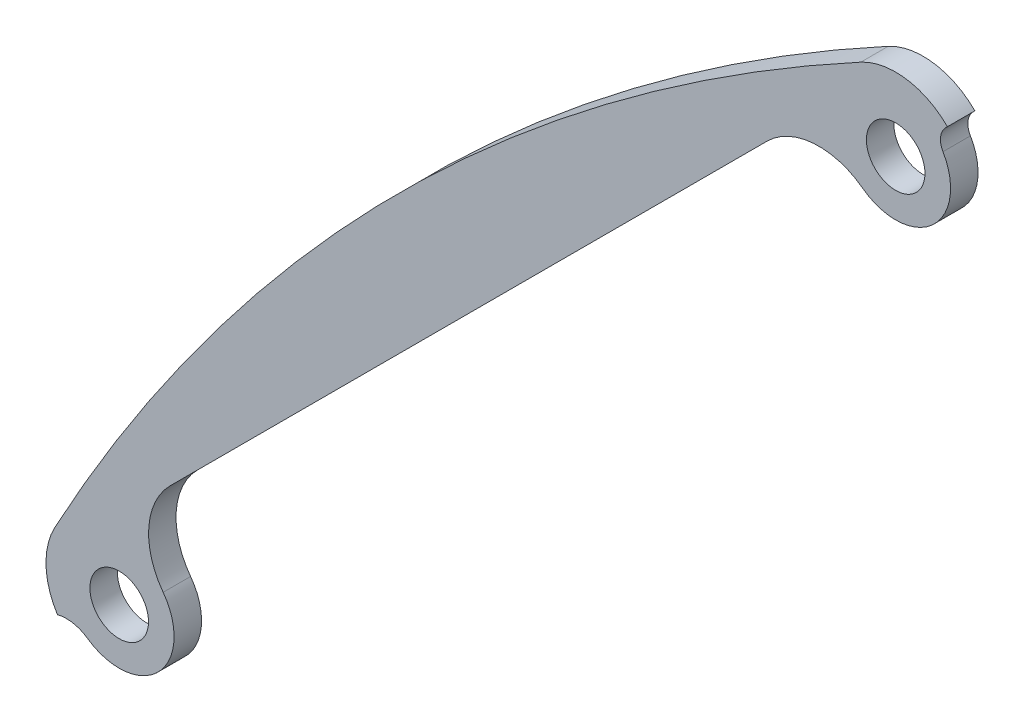
from build123d import *

# Parameters (mm, degrees)
FILLET1_OUTLINE_R    = 1.6
FILLET1_OUTLINE_R_2  = 1.4
FILLET1_DEPTH        = 1.5
FILLET2_R            = 1
FILLET3_R            = 4
FILLET6_R            = 1
FILLET7_R            = 1
FILLET8_R            = 2
BOSS_EXTRUDE1_DEPTH  = 1.5
FILLET9_R            = 4
BOSS_EXTRUDE2_START  = -1.5
SKETCH2_R            = 1.6
BOSS_EXTRUDE2_DEPTH  = 1.5
BOSS_EXTRUDE3_START  = -1.5
SKETCH3_R            = 1.6
BOSS_EXTRUDE3_DEPTH  = 1.5
CUT_EXTRUDE1_START   = -1.5
SKETCH4_R            = 1.6
CUT_EXTRUDE1_DEPTH   = 1.5
CUT_EXTRUDE3_DEPTH   = 10
FILLET10_R           = 2
SKETCH6_R            = 61
CUT_EXTRUDE4_DEPTH   = 10
CUT_EXTRUDE5_DEPTH   = 10
FILLET12_R           = 1
SKETCH8_R            = 1.6
BOSS_EXTRUDE5_DEPTH  = 5
CUT_EXTRUDE6_START   = -5
CUT_EXTRUDE6_DEPTH   = 5
SKETCH10_R           = 133.204065673
CUT_EXTRUDE7_DEPTH   = 1.5
FILLET13_R           = 1
FILLET14_R           = 2
CUT_EXTRUDE10_START  = -10
CUT_EXTRUDE10_DEPTH  = 10
BOSS_EXTRUDE10_DEPTH = 5
FILLET15_START       = 1
FILLET15_DEPTH       = 6
CUT_EXTRUDE13_START  = -10
CUT_EXTRUDE13_DEPTH  = 10
FILLET16_R           = 4
SKETCH14_R           = 214.053179588
CUT_EXTRUDE14_DEPTH  = 3.5


with BuildPart() as part:
    # Fillet1: read off the stored shape, not the designer's step
    # Fillet1 outline → Fillet1 (new body)
    with BuildSketch(Plane.XY):
        with BuildLine():
            Line((-52.766471043, 89.536023665), (-42.779960262, 79.549512884))
            Line((-42.779960262, 79.549512884), (-79.549512883, 42.779960262))
            Line((-79.549512883, 42.779960262), (-89.536023665, 52.766471043))
            ThreePointArc((-89.536023665, 52.766471043), (-92.941929118, 53.896139266), (-95.883096534, 51.840445591))
            ThreePointArc((-95.883096534, 51.840445591), (-109, 0), (-95.883096534, -51.840445591))
            ThreePointArc((-95.883096534, -51.840445591), (-92.941929118, -53.896139266), (-89.536023665, -52.766471043))
            Line((-89.536023665, -52.766471043), (-79.549512883, -42.779960262))
            Line((-79.549512883, -42.779960262), (-42.779960262, -79.549512883))
            Line((-42.779960262, -79.549512883), (-52.766471043, -89.536023665))
            ThreePointArc((-52.766471043, -89.536023665), (-53.896139266, -92.941929118), (-51.840445591, -95.883096534))
            ThreePointArc((-51.840445591, -95.883096534), (-50.184016899, -96.760345431), (-48.512748328, -97.608981399))
            ThreePointArc((-48.512748328, -97.608981399), (-47.646815155, -97.921093641), (-46.732463985, -98.02700043))
            Line((-46.732463985, -98.02700043), (46.732463985, -98.02700043))
            ThreePointArc((46.732463985, -98.02700043), (47.646815155, -97.921093641), (48.512748328, -97.608981399))
            ThreePointArc((48.512748328, -97.608981399), (50.184016899, -96.760345431), (51.840445591, -95.883096534))
            ThreePointArc((51.840445591, -95.883096534), (53.896139266, -92.941929118), (52.766471043, -89.536023665))
            Line((52.766471043, -89.536023665), (42.779960262, -79.549512884))
            Line((42.779960262, -79.549512884), (79.549512884, -42.779960262))
            Line((79.549512884, -42.779960262), (89.536023665, -52.766471043))
            ThreePointArc((89.536023665, -52.766471043), (92.941929118, -53.896139266), (95.883096534, -51.840445591))
            ThreePointArc((95.883096534, -51.840445591), (109, 0), (95.883096534, 51.840445591))
            ThreePointArc((95.883096534, 51.840445591), (92.941929118, 53.896139266), (89.536023665, 52.766471043))
            Line((89.536023665, 52.766471043), (79.549512883, 42.779960262))
            Line((79.549512883, 42.779960262), (42.779960262, 79.549512884))
            Line((42.779960262, 79.549512884), (52.766471043, 89.536023665))
            ThreePointArc((52.766471043, 89.536023665), (53.896139266, 92.941929118), (51.840445591, 95.883096534))
            ThreePointArc((51.840445591, 95.883096534), (51.446125895, 96.095245098), (51.050938033, 96.305772029))
            Line((51.050938033, 96.305772029), (31.745166004, 77))
            Line((31.745166004, 77), (-31.745166004, 77))
            Line((-31.745166004, 77), (-51.050938033, 96.305772029))
            ThreePointArc((-51.050938033, 96.305772029), (-51.446125895, 96.095245098), (-51.840445591, 95.883096534))
            ThreePointArc((-51.840445591, 95.883096534), (-53.896139266, 92.941929118), (-52.766471043, 89.536023665))
        make_face()
        with Locations((-92.27579683, -50.101669827)):
            Circle(FILLET1_OUTLINE_R, mode=Mode.SUBTRACT)
        with Locations((-50.101669828, -92.275796829)):
            Circle(FILLET1_OUTLINE_R, mode=Mode.SUBTRACT)
        with BuildLine():
            Line((-27.999999998, -90.02700043), (-41.861882029, -90.02700043))
            Line((-41.861882029, -90.02700043), (-37.123106012, -85.206367133))
            ThreePointArc((-37.123106012, -85.206367133), (-34.779960262, -79.549512884), (-37.123106012, -73.892658634))
            Line((-37.123106012, -73.892658634), (-44.194173825, -66.821590821))
            Line((-44.194173825, -66.821590821), (-35.419577284, -58.046994281))
            ThreePointArc((-35.419577284, -58.046994281), (-31.770328056, -60.12192824), (-27.999999998, -61.96773354))
            Line((-27.999999998, -61.96773354), (-27.999999998, -90.02700043))
        make_face(mode=Mode.SUBTRACT)
        with Locations((-23.999999998, -90)):
            Circle(FILLET1_OUTLINE_R, mode=Mode.SUBTRACT)
        with Locations((-46.492270863, -64.877047174)):
            Circle(FILLET1_OUTLINE_R_2, mode=Mode.SUBTRACT)
        with BuildLine():
            Line((-40.489419991, -54.631555614), (-48.436814511, -62.578950135))
            Line((-48.436814511, -62.578950135), (-62.479030953, -48.536733693))
            Line((-62.479030953, -48.536733693), (-54.492060142, -40.676963769))
            ThreePointArc((-54.492060142, -40.676963769), (-48.000552605, -48.165827612), (-40.489419991, -54.631555614))
        make_face(mode=Mode.SUBTRACT)
        with Locations((-40.835416614, -59.220192924)):
            Circle(FILLET1_OUTLINE_R_2, mode=Mode.SUBTRACT)
        with Locations((-64.877047174, -46.492270863)):
            Circle(FILLET1_OUTLINE_R_2, mode=Mode.SUBTRACT)
        with Locations((-59.220192925, -40.835416614)):
            Circle(FILLET1_OUTLINE_R_2, mode=Mode.SUBTRACT)
        with BuildLine():
            ThreePointArc((-73.892658634, -37.123106012), (-79.549512884, -34.779960262), (-85.206367133, -37.123106012))
            ThreePointArc((-85.206367133, -37.123106012), (-88.293174595, -40.113953283), (-91.303559052, -43.1817103))
            ThreePointArc((-91.303559052, -43.1817103), (-94.614957198, -35.341333794), (-97.254498611, -27.25))
            Line((-97.254498611, -27.25), (-62.301183777, -27.25))
            ThreePointArc((-62.301183777, -27.25), (-60.218013119, -31.58782829), (-57.833278956, -35.767469092))
            Line((-57.833278956, -35.767469092), (-66.690457063, -44.325307583))
            Line((-66.690457063, -44.325307583), (-73.892658634, -37.123106012))
        make_face(mode=Mode.SUBTRACT)
        with Locations((-98, -23.25)):
            Circle(FILLET1_OUTLINE_R, mode=Mode.SUBTRACT)
        with Locations((-68.5, -23.25)):
            Circle(FILLET1_OUTLINE_R, mode=Mode.SUBTRACT)
        with Locations((23.999999998, -90)):
            Circle(FILLET1_OUTLINE_R, mode=Mode.SUBTRACT)
        with Locations((50.101669827, -92.275796829)):
            Circle(FILLET1_OUTLINE_R, mode=Mode.SUBTRACT)
        with BuildLine():
            ThreePointArc((28, -61.967733539), (31.770328056, -60.121928239), (35.419577283, -58.046994281))
            Line((35.419577283, -58.046994281), (44.194173824, -66.821590822))
            Line((44.194173824, -66.821590822), (37.123106012, -73.892658634))
            ThreePointArc((37.123106012, -73.892658634), (34.779960262, -79.549512884), (37.123106012, -85.206367133))
            ThreePointArc((37.123106012, -85.206367133), (39.468585064, -87.64018675), (41.861882029, -90.02700043))
            Line((41.861882029, -90.02700043), (28, -90.02700043))
            Line((28, -90.02700043), (28, -61.967733539))
        make_face(mode=Mode.SUBTRACT)
        with Locations((46.492270863, -64.877047174)):
            Circle(FILLET1_OUTLINE_R_2, mode=Mode.SUBTRACT)
        with Locations((40.835416614, -59.220192924)):
            Circle(FILLET1_OUTLINE_R_2, mode=Mode.SUBTRACT)
        with BuildLine():
            Line((62.479030953, -48.536733693), (48.436814511, -62.578950135))
            Line((48.436814511, -62.578950135), (40.489419991, -54.631555614))
            ThreePointArc((40.489419991, -54.631555614), (48.000552605, -48.165827612), (54.492060142, -40.676963769))
            Line((54.492060142, -40.676963769), (62.479030953, -48.536733693))
        make_face(mode=Mode.SUBTRACT)
        with Locations((92.27579683, -50.101669827)):
            Circle(FILLET1_OUTLINE_R, mode=Mode.SUBTRACT)
        with BuildLine():
            ThreePointArc((-20, -56.568542495), (0, 60), (20, -56.568542495))
            Line((20, -56.568542495), (20, -94.013500215))
            Line((20, -94.013500215), (-4e-09, -94.02700043))
            Line((-4e-09, -94.02700043), (-20, -94.013500215))
            Line((-20, -94.013500215), (-20, -56.568542495))
        make_face(mode=Mode.SUBTRACT)
        with Locations((64.877047174, -46.492270863)):
            Circle(FILLET1_OUTLINE_R_2, mode=Mode.SUBTRACT)
        with Locations((59.220192924, -40.835416614)):
            Circle(FILLET1_OUTLINE_R_2, mode=Mode.SUBTRACT)
        with BuildLine():
            Line((62.301183777, -27.25), (97.254498611, -27.25))
            ThreePointArc((97.254498611, -27.25), (94.614957198, -35.341333794), (91.303559052, -43.1817103))
            ThreePointArc((91.303559052, -43.1817103), (88.293174595, -40.113953283), (85.206367133, -37.123106012))
            ThreePointArc((85.206367133, -37.123106012), (79.549512884, -34.779960262), (73.892658634, -37.123106012))
            Line((73.892658634, -37.123106012), (66.690457063, -44.325307584))
            Line((66.690457063, -44.325307584), (57.833278956, -35.767469092))
            ThreePointArc((57.833278956, -35.767469092), (60.218013119, -31.58782829), (62.301183777, -27.25))
        make_face(mode=Mode.SUBTRACT)
        with Locations((68.5, -23.25)):
            Circle(FILLET1_OUTLINE_R, mode=Mode.SUBTRACT)
        with Locations((98, -23.25)):
            Circle(FILLET1_OUTLINE_R, mode=Mode.SUBTRACT)
        with BuildLine():
            ThreePointArc((-99.148562773, -19.25), (-101, 0), (-99.148562773, 19.25))
            Line((-99.148562773, 19.25), (-65.218383145, 19.25))
            ThreePointArc((-65.218383145, 19.25), (-68, 0), (-65.218383145, -19.25))
            Line((-65.218383145, -19.25), (-99.148562773, -19.25))
        make_face(mode=Mode.SUBTRACT)
        with Locations((-98, 23.25)):
            Circle(FILLET1_OUTLINE_R, mode=Mode.SUBTRACT)
        with Locations((-64, 0)):
            Circle(FILLET1_OUTLINE_R, mode=Mode.SUBTRACT)
        with Locations((-68.5, 23.25)):
            Circle(FILLET1_OUTLINE_R, mode=Mode.SUBTRACT)
        with BuildLine():
            Line((-62.301183777, 27.25), (-97.254498611, 27.25))
            ThreePointArc((-97.254498611, 27.25), (-94.614957198, 35.341333794), (-91.303559052, 43.1817103))
            ThreePointArc((-91.303559052, 43.1817103), (-88.293174595, 40.113953283), (-85.206367133, 37.123106012))
            ThreePointArc((-85.206367133, 37.123106012), (-79.549512884, 34.779960262), (-73.892658634, 37.123106012))
            Line((-73.892658634, 37.123106012), (-66.690457063, 44.325307584))
            Line((-66.690457063, 44.325307584), (-57.833278956, 35.767469092))
            ThreePointArc((-57.833278956, 35.767469092), (-60.218013119, 31.58782829), (-62.301183777, 27.25))
        make_face(mode=Mode.SUBTRACT)
        with Locations((-59.220192925, 40.835416614)):
            Circle(FILLET1_OUTLINE_R_2, mode=Mode.SUBTRACT)
        with Locations((-64.877047174, 46.492270863)):
            Circle(FILLET1_OUTLINE_R_2, mode=Mode.SUBTRACT)
        with Locations((-92.27579683, 50.101669827)):
            Circle(FILLET1_OUTLINE_R, mode=Mode.SUBTRACT)
        with BuildLine():
            ThreePointArc((-40.489419991, 54.631555614), (-48.000552605, 48.165827612), (-54.492060142, 40.676963769))
            Line((-54.492060142, 40.676963769), (-62.479030953, 48.536733693))
            Line((-62.479030953, 48.536733693), (-48.436814511, 62.578950135))
            Line((-48.436814511, 62.578950135), (-40.489419991, 54.631555614))
        make_face(mode=Mode.SUBTRACT)
        with Locations((-40.835416614, 59.220192924)):
            Circle(FILLET1_OUTLINE_R_2, mode=Mode.SUBTRACT)
        with Locations((-46.492270863, 64.877047174)):
            Circle(FILLET1_OUTLINE_R_2, mode=Mode.SUBTRACT)
        with BuildLine():
            Line((-44.194173824, 66.821590822), (-40.015764646, 71))
            Line((-40.015764646, 71), (-31.745166004, 71))
            Line((-31.745166004, 71), (-18.99999793, 70.951058904))
            Line((-18.99999793, 70.951058904), (-18.999992628, 68.264642036))
            Line((-18.999992628, 68.264642036), (-19.01142159, 65.288328583))
            ThreePointArc((-19.01142159, 65.288328583), (-27.455284376, 62.210990667), (-35.419577283, 58.046994281))
            Line((-35.419577283, 58.046994281), (-44.194173824, 66.821590822))
        make_face(mode=Mode.SUBTRACT)
        with Locations((-15, 66.122776602)):
            Circle(FILLET1_OUTLINE_R, mode=Mode.SUBTRACT)
        with Locations((-36.042175759, 77.089910724)):
            Circle(FILLET1_OUTLINE_R, mode=Mode.SUBTRACT)
        with Locations((-51.089613767, 91.732498958)):
            Circle(FILLET1_OUTLINE_R, mode=Mode.SUBTRACT)
        with Locations((64, 0)):
            Circle(FILLET1_OUTLINE_R, mode=Mode.SUBTRACT)
        with Locations((68.5, 23.25)):
            Circle(FILLET1_OUTLINE_R, mode=Mode.SUBTRACT)
        with BuildLine():
            ThreePointArc((99.148562773, 19.25), (101, 0), (99.148562773, -19.25))
            Line((99.148562773, -19.25), (65.218383145, -19.25))
            ThreePointArc((65.218383145, -19.25), (68, 0), (65.218383145, 19.25))
            Line((65.218383145, 19.25), (99.148562773, 19.25))
        make_face(mode=Mode.SUBTRACT)
        with Locations((98, 23.25)):
            Circle(FILLET1_OUTLINE_R, mode=Mode.SUBTRACT)
        with Locations((59.220192924, 40.835416614)):
            Circle(FILLET1_OUTLINE_R_2, mode=Mode.SUBTRACT)
        with Locations((64.877047174, 46.492270863)):
            Circle(FILLET1_OUTLINE_R_2, mode=Mode.SUBTRACT)
        with BuildLine():
            ThreePointArc((73.892658634, 37.123106012), (79.549512884, 34.779960262), (85.206367133, 37.123106012))
            ThreePointArc((85.206367133, 37.123106012), (88.293174595, 40.113953283), (91.303559052, 43.1817103))
            ThreePointArc((91.303559052, 43.1817103), (94.614957198, 35.341333794), (97.254498611, 27.25))
            Line((97.254498611, 27.25), (62.301183777, 27.25))
            ThreePointArc((62.301183777, 27.25), (60.218013119, 31.58782829), (57.833278956, 35.767469092))
            Line((57.833278956, 35.767469092), (66.690457063, 44.325307583))
            Line((66.690457063, 44.325307583), (73.892658634, 37.123106012))
        make_face(mode=Mode.SUBTRACT)
        with Locations((0, 64)):
            Circle(FILLET1_OUTLINE_R, mode=Mode.SUBTRACT)
        with BuildLine():
            Line((-11, 67.104396279), (-11, 70.930497512))
            Line((-11, 70.930497512), (0, 71))
            Line((0, 71), (11, 71))
            Line((11, 71), (11, 67.104396279))
            ThreePointArc((11, 67.104396279), (0, 68), (-11, 67.104396279))
        make_face(mode=Mode.SUBTRACT)
        with Locations((15, 66.122776602)):
            Circle(FILLET1_OUTLINE_R, mode=Mode.SUBTRACT)
        with Locations((40.835416614, 59.220192924)):
            Circle(FILLET1_OUTLINE_R_2, mode=Mode.SUBTRACT)
        with BuildLine():
            ThreePointArc((54.492060142, 40.676963769), (48.000552606, 48.165827612), (40.489419991, 54.631555614))
            Line((40.489419991, 54.631555614), (48.436814511, 62.578950135))
            Line((48.436814511, 62.578950135), (62.479030953, 48.536733693))
            Line((62.479030953, 48.536733693), (54.492060142, 40.676963769))
        make_face(mode=Mode.SUBTRACT)
        with BuildLine():
            Line((19.012475672, 65.288021634), (18.990729901, 70.951023316))
            Line((18.990729901, 70.951023316), (31.745166003, 71))
            Line((31.745166003, 71), (40.015764645, 71))
            Line((40.015764645, 71), (44.194173823, 66.821590822))
            Line((44.194173823, 66.821590822), (35.419577282, 58.046994281))
            ThreePointArc((35.419577282, 58.046994281), (27.455786576, 62.210769032), (19.012475672, 65.288021634))
        make_face(mode=Mode.SUBTRACT)
        with Locations((46.492270863, 64.877047174)):
            Circle(FILLET1_OUTLINE_R_2, mode=Mode.SUBTRACT)
        with Locations((36.042175759, 77.089910724)):
            Circle(FILLET1_OUTLINE_R, mode=Mode.SUBTRACT)
        with Locations((51.089613767, 91.732498958)):
            Circle(FILLET1_OUTLINE_R, mode=Mode.SUBTRACT)
        with Locations((92.27579683, 50.101669827)):
            Circle(FILLET1_OUTLINE_R, mode=Mode.SUBTRACT)
    extrude(amount=FILLET1_DEPTH)

    # Fillet2
    fillet2_edges = [part.edges().sort_by_distance(p)[0] for p in [
        (-51.050938033, 96.305772029, 0.75),
        (51.050938033, 96.305772029, 0.75),
    ]]
    fillet(fillet2_edges, radius=FILLET2_R)

    # Fillet3
    fillet3_edges = [part.edges().sort_by_distance(p)[0] for p in [
        (-31.745166004, 77, 0.75),
        (31.745166004, 77, 0.75),
    ]]
    fillet(fillet3_edges, radius=FILLET3_R)

    # Fillet6
    fillet6_edges = [part.edges().sort_by_distance(p)[0] for p in [
        (-48.436814511, 62.578950135, 0.75),
        (-40.489419991, 54.631555614, 0.75),
        (-62.479030953, 48.536733693, 0.75),
        (-54.492060142, 40.676963769, 0.75),
        (-44.194173824, 66.821590822, 0.75),
        (-40.015764646, 71, 0.75),
        (-35.419577283, 58.046994281, 0.75),
        (-19.01142159, 65.288328583, 0.75),
        (-18.99999793, 70.951058904, 0.75),
        (-31.745166004, 71, 0.75),
        (-57.833278956, 35.767469092, 0.75),
        (-66.690457063, 44.325307584, 0.75),
        (19.012475672, 65.288021634, 0.75),
        (18.990729901, 70.951023316, 0.75),
        (35.419577282, 58.046994281, 0.75),
        (44.194173823, 66.821590822, 0.75),
        (40.015764645, 71, 0.75),
        (31.745166003, 71, 0.75),
        (54.492060142, 40.676963769, 0.75),
        (40.489419991, 54.631555614, 0.75),
        (62.479030953, 48.536733693, 0.75),
        (48.436814511, 62.578950135, 0.75),
        (-11, 67.104396279, 0.75),
        (-11, 70.930497512, 0.75),
        (11, 67.104396279, 0.75),
        (11, 71, 0.75),
    ]]
    fillet(fillet6_edges, radius=FILLET6_R)

    # Fillet7
    fillet7_edges = [part.edges().sort_by_distance(p)[0] for p in [
        (40.489419991, -54.631555614, 0.75),
        (54.492060142, -40.676963769, 0.75),
        (48.436814511, -62.578950135, 0.75),
        (62.479030953, -48.536733693, 0.75),
        (-54.492060142, -40.676963769, 0.75),
        (-40.489419991, -54.631555614, 0.75),
        (-62.479030953, -48.536733693, 0.75),
        (-48.436814511, -62.578950135, 0.75),
        (66.690457063, 44.325307583, 0.75),
        (57.833278956, 35.767469092, 0.75),
        (62.301183777, 27.25, 0.75),
        (97.254498611, 27.25, 0.75),
        (91.303559052, 43.1817103, 0.75),
        (-99.148562773, 19.25, 0.75),
        (-99.148562773, -19.25, 0.75),
        (-65.218383145, -19.25, 0.75),
        (-65.218383145, 19.25, 0.75),
        (-66.690457063, -44.325307583, 0.75),
        (-57.833278956, -35.767469092, 0.75),
        (-62.301183777, -27.25, 0.75),
        (-97.254498611, -27.25, 0.75),
        (-91.303559052, -43.1817103, 0.75),
        (-62.301183777, 27.25, 0.75),
        (-97.254498611, 27.25, 0.75),
        (-91.303559052, 43.1817103, 0.75),
        (62.301183777, -27.25, 0.75),
        (97.254498611, -27.25, 0.75),
        (57.833278956, -35.767469092, 0.75),
        (66.690457063, -44.325307584, 0.75),
        (91.303559052, -43.1817103, 0.75),
        (99.148562773, -19.25, 0.75),
        (99.148562773, 19.25, 0.75),
        (65.218383145, 19.25, 0.75),
        (65.218383145, -19.25, 0.75),
        (28, -61.967733539, 0.75),
        (35.419577283, -58.046994281, 0.75),
        (28, -90.02700043, 0.75),
        (41.861882029, -90.02700043, 0.75),
        (44.194173824, -66.821590822, 0.75),
        (-41.861882029, -90.02700043, 0.75),
        (-27.999999998, -90.02700043, 0.75),
        (-27.999999998, -61.96773354, 0.75),
        (-35.419577284, -58.046994281, 0.75),
        (-44.194173825, -66.821590821, 0.75),
    ]]
    fillet(fillet7_edges, radius=FILLET7_R)

    # Fillet8
    fillet8_edges = [part.edges().sort_by_distance(p)[0] for p in [
        (20, -56.568542495, 0.75),
        (-20, -56.568542495, 0.75),
        (-20, -94.013500215, 0.75),
        (20, -94.013500215, 0.75),
        (-42.779960262, 79.549512884, 0.75),
        (42.779960262, 79.549512884, 0.75),
        (79.549512883, 42.779960262, 0.75),
        (79.549512884, -42.779960262, 0.75),
        (42.779960262, -79.549512884, 0.75),
        (-42.779960262, -79.549512883, 0.75),
        (-79.549512883, -42.779960262, 0.75),
        (-79.549512883, 42.779960262, 0.75),
    ]]
    fillet(fillet8_edges, radius=FILLET8_R)

    # Sketch1 → Boss-Extrude1 (add)
    with BuildSketch(Plane.XY.offset(1.5)):
        Polygon((51.840445591, 95.883096534), (49.820140502, 97.903401623), (28.916738879, 77), (30.937043968, 74.979694911), align=None)
        Polygon((-30.937043968, 74.979694911), (-51.840445591, 95.883096534), (-49.820140502, 97.903401623), (-28.916738879, 77), align=None)
    extrude(amount=-BOSS_EXTRUDE1_DEPTH)

    # Fillet9
    # the kernel refuses this fillet: 4 mm, written as the material it takes off along each edge
    with BuildSketch(Plane(origin=(49.820140502, 97.903401623, 11.083148475), x_dir=(-0.7071067811865457, -0.7071067811865495, 0), z_dir=(0, 0, -1))) as fillet9_piece_1:
        with BuildLine():
            CenterArc((3.83325939, -4), FILLET9_R, 90, 73.398450397)
            Line((0, -2.857142857), (-0.076665188, -2.834285714))
            ThreePointArc((-0.076665188, -2.834285714), (-0.08, -1.428571428), (-0.08, 0))
            Line((-0.08, 0), (0, 0.08))
            Line((0, 0.08), (3.83325939, 0.08))
            Line((3.83325939, 0.08), (3.83325939, 0))
        make_face()
    extrude(amount=20.66629695, mode=Mode.SUBTRACT)
    with BuildSketch(Plane(origin=(-49.820140502, 97.903401623, 11.083148475), x_dir=(-0.7071067811734814, -0.7071067811996137, 0), z_dir=(0, 0, -1))) as fillet9_piece_2:
        with BuildLine():
            CenterArc((4, -3.83325939), FILLET9_R, 106.601549604, 73.398450397)
            Line((0, -3.83325939), (-0.08, -3.83325939))
            Line((-0.08, -3.83325939), (-0.08, 0))
            Line((-0.08, 0), (0, 0.08))
            ThreePointArc((0, 0.08), (1.428571428, 0.08), (2.834285714, 0.076665188))
            Line((2.834285714, 0.076665188), (2.857142857, 0))
        make_face()
    extrude(amount=20.66629695, mode=Mode.SUBTRACT)

    # Sketch2 → Boss-Extrude2 (add)
    with BuildSketch(Plane.XY.offset(1.5).offset(BOSS_EXTRUDE2_START)):
        with Locations((51.089613767, 91.732498958)):
            Circle(SKETCH2_R)
    extrude(amount=BOSS_EXTRUDE2_DEPTH)

    # Sketch3 → Boss-Extrude3 (add)
    with BuildSketch(Plane.XY.offset(1.5).offset(BOSS_EXTRUDE3_START)):
        with Locations((-92.27579683, 50.101669827)):
            Circle(SKETCH3_R)
        with Locations((-92.27579683, -50.101669827)):
            Circle(SKETCH3_R)
        with Locations((92.364450789, 49.938043918)):
            Circle(SKETCH3_R)
        with Locations((-50.101669828, -92.275796829)):
            Circle(SKETCH3_R)
        with Locations((50.101669827, -92.275796829)):
            Circle(SKETCH3_R)
        with Locations((92.27579683, -50.101669827)):
            Circle(SKETCH3_R)
        with Locations((-51.089613767, 91.732498958)):
            Circle(SKETCH3_R)
    extrude(amount=BOSS_EXTRUDE3_DEPTH)

    # Sketch4 → Cut-Extrude1 (cut)
    with BuildSketch(Plane.XY.offset(1.5).offset(CUT_EXTRUDE1_START)):
        with Locations((92.364450789, 49.938043918)):
            Circle(SKETCH4_R)
        with Locations((49.938043918, 92.364450789)):
            Circle(SKETCH4_R)
        with Locations((-92.364450789, 49.938043918)):
            Circle(SKETCH4_R)
        with Locations(Location((-49.938043918, 92.364450789, 0), (0, 0, 180))):
            Circle(SKETCH4_R)
        with Locations(Location((-92.364450789, -49.938043918, 0), (0, 0, 180))):
            Circle(SKETCH4_R)
        with Locations((-49.938043918, -92.364450789)):
            Circle(SKETCH4_R)
        with Locations(Location((49.938043918, -92.364450789, 0), (0, 0, 180))):
            Circle(SKETCH4_R)
        with Locations((92.364450789, -49.938043918)):
            Circle(SKETCH4_R)
    extrude(amount=CUT_EXTRUDE1_DEPTH, mode=Mode.SUBTRACT)

    # Sketch5 → Cut-Extrude3 (cut)
    with BuildSketch(Plane.XY.offset(1.5)):
        Polygon((41.365746702, 78.135299324), (78.135299324, 41.365746702), (85.249875055, 48.480322434), (48.480322433, 85.249875055), align=None)
        Polygon((-48.480322433, 85.249875055), (-85.249875055, 48.480322434), (-78.135299324, 41.365746702), (-41.365746702, 78.135299324), align=None)
        Polygon((-41.365746702, -78.135299324), (-78.135299324, -41.365746702), (-85.249875055, -48.480322433), (-48.480322433, -85.249875055), align=None)
        Polygon((48.480322433, -85.249875055), (85.249875055, -48.480322433), (78.135299324, -41.365746702), (41.365746702, -78.135299324), align=None)
    extrude(amount=-CUT_EXTRUDE3_DEPTH, mode=Mode.SUBTRACT)

    # Fillet10
    fillet10_edges = [part.edges().sort_by_distance(p)[0] for p in [
        (-41.365746702, 78.135299324, 0.75),
        (-78.135299324, 41.365746702, 0.75),
        (78.135299324, 41.365746702, 0.75),
        (41.365746702, 78.135299324, 0.75),
        (-78.135299324, -41.365746702, 0.75),
        (-41.365746702, -78.135299324, 0.75),
        (41.365746702, -78.135299324, 0.75),
        (78.135299324, -41.365746702, 0.75),
    ]]
    fillet(fillet10_edges, radius=FILLET10_R)

    # Sketch6 → Cut-Extrude4 (cut)
    with BuildSketch(Plane.XY.offset(1.5)):
        Circle(SKETCH6_R)
    extrude(amount=-CUT_EXTRUDE4_DEPTH, mode=Mode.SUBTRACT)

    # Sketch7 → Cut-Extrude5 (cut)
    with BuildSketch(Plane.XY.offset(1.5)):
        Polygon((-21, -74.990178383), (-21, -49.799253287), (21, -49.799253287), (21, -74.990178383), (21, -95.02700043), (0, -95.02700043), (-21, -95.02700043), align=None)
    extrude(amount=-CUT_EXTRUDE5_DEPTH, mode=Mode.SUBTRACT)

    # Fillet12
    fillet12_edges = [part.edges().sort_by_distance(p)[0] for p in [
        (21, -57.271284253, 0.75),
        (-21, -57.271284253, 0.75),
        (21, -95.02700043, 0.75),
        (-21, -95.02700043, 0.75),
    ]]
    fillet(fillet12_edges, radius=FILLET12_R)

    # Sketch8 → Boss-Extrude5 (add)
    with BuildSketch(Plane.XY.offset(1.5)):
        with BuildLine():
            ThreePointArc((-51.840445591, -95.883096534), (-46.514100829, -90.296453274), (-53.93777787, -92.41058445))
            ThreePointArc((-53.93777787, -92.41058445), (-75.660425587, -75.660425587), (-92.41058445, -53.93777787))
            ThreePointArc((-92.41058445, -53.93777787), (-88.845805045, -48.035642245), (-95.736430137, -47.786357306))
            ThreePointArc((-95.736430137, -47.786357306), (-107, 0), (-95.736430137, 47.786357306))
            ThreePointArc((-95.736430137, 47.786357306), (-88.845805045, 48.035642245), (-92.41058445, 53.93777787))
            ThreePointArc((-92.41058445, 53.93777787), (-75.660425587, 75.660425587), (-53.93777787, 92.41058445))
            ThreePointArc((-53.93777787, 92.41058445), (-46.514100829, 90.296453274), (-51.840445591, 95.883096534))
            ThreePointArc((-51.840445591, 95.883096534), (-109, 0), (-51.840445591, -95.883096534))
        make_face()
        with Locations((-49.938043918, -92.364450789)):
            Circle(SKETCH8_R, mode=Mode.SUBTRACT)
        with Locations((-92.364450789, -49.938043918)):
            Circle(SKETCH8_R, mode=Mode.SUBTRACT)
        with Locations((-92.364450789, 49.938043918)):
            Circle(SKETCH8_R, mode=Mode.SUBTRACT)
        with Locations((-49.938043918, 92.364450789)):
            Circle(SKETCH8_R, mode=Mode.SUBTRACT)
    extrude(amount=BOSS_EXTRUDE5_DEPTH)

    # Sketch9 → Cut-Extrude6 (cut)
    with BuildSketch(Plane.XY.offset(6.5).offset(CUT_EXTRUDE6_START)):
        with BuildLine():
            Line((-94.8934353, -48.324278959), (-95.736430137, -47.786357306))
            ThreePointArc((-95.736430137, -47.786357306), (-88.85683433, -48.01538254), (-92.364450789, -53.938043918))
            Line((-92.364450789, -53.938043918), (-92.364450789, -52.938043918))
            ThreePointArc((-92.364450789, -52.938043918), (-89.733738445, -48.496047884), (-94.8934353, -48.324278959))
        make_face()
        with BuildLine():
            Line((-52.938043918, -92.364450789), (-53.938043918, -92.364450789))
            ThreePointArc((-53.938043918, -92.364450789), (-48.407310189, -88.668932659), (-47.109616793, -95.192877914))
            Line((-47.109616793, -95.192877914), (-47.816723575, -94.485771133))
            ThreePointArc((-47.816723575, -94.485771133), (-48.789993621, -89.592812192), (-52.938043918, -92.364450789))
        make_face()
        with BuildLine():
            Line((-47.816723575, 94.485771133), (-47.109616793, 95.192877914))
            ThreePointArc((-47.109616793, 95.192877914), (-48.407310189, 88.668932659), (-53.938043918, 92.364450789))
            Line((-53.938043918, 92.364450789), (-52.938043918, 92.364450789))
            ThreePointArc((-52.938043918, 92.364450789), (-48.789993621, 89.592812192), (-47.816723575, 94.485771133))
        make_face()
        with BuildLine():
            Line((-92.364450789, 53.938043918), (-92.364450789, 52.938043918))
            ThreePointArc((-92.364450789, 52.938043918), (-89.733738445, 48.496047884), (-94.8934353, 48.324278959))
            Line((-94.8934353, 48.324278959), (-95.736430137, 47.786357306))
            ThreePointArc((-95.736430137, 47.786357306), (-88.85683433, 48.01538254), (-92.364450789, 53.938043918))
        make_face()
    extrude(amount=CUT_EXTRUDE6_DEPTH, mode=Mode.SUBTRACT)

    # Sketch10 → Cut-Extrude7 (cut)
    with BuildSketch(Plane(origin=(0, 0, 0), x_dir=(-1, 0, 0), z_dir=(0, 0, -1))):
        Circle(SKETCH10_R)
    extrude(amount=-CUT_EXTRUDE7_DEPTH, mode=Mode.SUBTRACT)

    # Fillet13
    fillet13_edges = [part.edges().sort_by_distance(p)[0] for p in [
        (-47.816723575, -94.485771133, 4),
        (-47.816723575, 94.485771133, 4),
    ]]
    fillet(fillet13_edges, radius=FILLET13_R)

    # Fillet14
    # the kernel refuses this fillet: 2 mm, written as the material it adds along each edge
    with BuildSketch(Plane(origin=(-52.938043918, 92.364450789, 1.5), x_dir=(0.19364916731417084, -0.9810708435166791, 0), z_dir=(0, 0, 1))) as fillet14_piece_1:
        with BuildLine():
            CenterArc((1.549193339, -1.962141687), FILLET14_R, 101.165822505, 49.458398129)
            Line((-0.193649167, -0.981070844), (-0.228506017, -0.961449427))
            ThreePointArc((-0.228506017, -0.961449427), (-0.136067417, -0.482789455), (-0.039242834, 0.007745967))
            Line((-0.039242834, 0.007745967), (0.007745967, 0.039242834))
            ThreePointArc((0.007745967, 0.039242834), (0.580947502, -0.016787469), (1.154149037, 0.039242834))
            Line((1.154149037, 0.039242834), (1.161895004, 0))
        make_face()
    extrude(amount=5)
    with BuildSketch(Plane(origin=(-92.364450789, 52.938043918, 1.5), x_dir=(0.9810708435182302, -0.19364916730631312, 0), z_dir=(0, 0, 1)), Plane(origin=(-94.8934353, -48.324278959, 1.5), x_dir=(0.6909844981380313, 0.7228695756033262, 0), z_dir=(0, 0, 1))) as fillet14_piece_2:
        with BuildLine():
            CenterArc((1.549193338, 1.962141687), FILLET14_R, 209.375779372, 49.458398123)
            Line((-0.193649167, 0.981070843), (-0.228506017, 0.961449427))
            ThreePointArc((-0.228506017, 0.961449427), (-0.136067417, 0.482789455), (-0.039242834, -0.007745967))
            Line((-0.039242834, -0.007745967), (0.007745967, -0.039242834))
            ThreePointArc((0.007745967, -0.039242834), (0.580947502, 0.016787469), (1.154149037, -0.039242834))
            Line((1.154149037, -0.039242834), (1.161895004, 0))
        make_face()
    extrude(amount=5)
    with BuildSketch(Plane(origin=(-94.8934353, 48.324278959, 1.5), x_dir=(-0.8429948368990979, -0.5379216531814491, 0), z_dir=(0, 0, 1))) as fillet14_piece_3:
        with BuildLine():
            CenterArc((1.625, 1.899835519), FILLET14_R, 202.331645004, 49.458398131)
            Line((-0.225, 1.139901312), (-0.262, 1.124702628))
            ThreePointArc((-0.262, 1.124702628), (-0.096030303, 0.573201535), (-0.04, 0))
            Line((-0.04, 0), (0, -0.04))
            ThreePointArc((0, -0.04), (0.5, -0.04), (0.9875, -0.03799671))
            Line((0.9875, -0.03799671), (1, 0))
        make_face()
    extrude(amount=5)
    with BuildSketch(Plane(origin=(-92.364450789, -52.938043918, 1.5), x_dir=(0, -1, 0), z_dir=(0, 0, 1))) as fillet14_piece_4:
        with BuildLine():
            CenterArc((1.625, 1.899835519), FILLET14_R, 202.331645009, 49.458398123)
            Line((-0.225, 1.139901311), (-0.262, 1.124702627))
            ThreePointArc((-0.262, 1.124702627), (-0.096030303, 0.573201535), (-0.04, 0))
            Line((-0.04, 0), (0, -0.04))
            ThreePointArc((0, -0.04), (0.5, -0.04), (0.9875, -0.03799671))
            Line((0.9875, -0.03799671), (1, 0))
        make_face()
    extrude(amount=5)
    with BuildSketch(Plane(origin=(-52.938043918, -92.364450789, 1.5), x_dir=(0.19364916731417084, 0.9810708435166791, 0), z_dir=(0, 0, 1))) as fillet14_piece_5:
        with BuildLine():
            CenterArc((1.549193339, 1.962141687), FILLET14_R, 209.375779366, 49.458398129)
            Line((-0.193649167, 0.981070844), (-0.228506017, 0.961449427))
            ThreePointArc((-0.228506017, 0.961449427), (-0.136067417, 0.482789455), (-0.039242834, -0.007745967))
            Line((-0.039242834, -0.007745967), (0.007745967, -0.039242834))
            ThreePointArc((0.007745967, -0.039242834), (0.580947502, 0.016787469), (1.154149037, -0.039242834))
            Line((1.154149037, -0.039242834), (1.161895004, 0))
        make_face()
    extrude(amount=5)

    # Sketch11 → Cut-Extrude10 (cut)
    with BuildSketch(Plane.XY.offset(6.5).offset(CUT_EXTRUDE10_START)):
        with BuildLine():
            Line((-88.364450789, 49.938043918), (9.82122629, 9.54949028))
            Line((9.82122629, 9.54949028), (-5.943869165, -97.504332158))
            Line((-5.943869165, -97.504332158), (-89.530841379, -105.956947326))
            Line((-89.530841379, -105.956947326), (-146.820788627, 13.944964128))
            Line((-146.820788627, 13.944964128), (-95.883096534, 51.840445591))
            ThreePointArc((-95.883096534, 51.840445591), (-93.345627894, 46.06024925), (-88.364450789, 49.938043918))
        make_face()
    extrude(amount=CUT_EXTRUDE10_DEPTH, mode=Mode.SUBTRACT)

    # Sketch12 → Boss-Extrude10 (add)
    with BuildSketch(Plane.XY.offset(6.5)):
        Polygon((-93.436498454, 53.93777787), (-92.410389265, 53.937973055), (-53.93777787, 92.41058445), (-56.617507196, 92.364450789), (-71.854770116, 80.829786623), (-85.355729389, 66.224878191), align=None)
    extrude(amount=-BOSS_EXTRUDE10_DEPTH)

    # Fillet15: read off the stored shape, not the designer's step
    # Fillet15 outline → Fillet15 (cut)
    with BuildSketch(Plane.XY.offset(FILLET15_START)):
        with BuildLine():
            ThreePointArc((-53.603687452, 92.219504205), (-53.771652019, 92.313436894), (-53.93777787, 92.41058445))
            ThreePointArc((-53.93777787, 92.41058445), (-53.937977406, 92.387518003), (-53.938043918, 92.364450789))
            ThreePointArc((-53.938043918, 92.364450789), (-53.767557444, 92.299608804), (-53.603687452, 92.219504205))
        make_face()
        with BuildLine():
            ThreePointArc((-92.41058445, 53.93777787), (-92.313436894, 53.77165202), (-92.219504205, 53.603687453))
            ThreePointArc((-92.219504205, 53.603687453), (-92.299608804, 53.767557444), (-92.364450789, 53.938043918))
            ThreePointArc((-92.364450789, 53.938043918), (-92.387518003, 53.937977406), (-92.41058445, 53.93777787))
        make_face()
    extrude(amount=FILLET15_DEPTH, mode=Mode.SUBTRACT)

    # Sketch13 → Cut-Extrude13 (cut)
    with BuildSketch(Plane.XY.offset(6.5).offset(CUT_EXTRUDE13_START)):
        with BuildLine():
            Line((-91.224549478, 52.713043918), (-52.713043918, 91.224549478))
            ThreePointArc((-52.713043918, 91.224549478), (-52.879536719, 92.954043956), (-52.059364262, 94.485771133))
            Line((-52.059364262, 94.485771133), (-94.485771133, 52.059364262))
            ThreePointArc((-94.485771133, 52.059364262), (-92.954043956, 52.879536719), (-91.224549478, 52.713043918))
        make_face()
    extrude(amount=CUT_EXTRUDE13_DEPTH, mode=Mode.SUBTRACT)

    # Fillet16
    fillet16_edges = [part.edges().sort_by_distance(p)[0] for p in [
        (-52.059364262, 94.485771133, 4),
    ]]
    fillet(fillet16_edges, radius=FILLET16_R)
    fillet16_2_edges = [part.edges().sort_by_distance(p)[0] for p in [
        (-94.485771133, 52.059364262, 4),
    ]]
    fillet(fillet16_2_edges, radius=FILLET16_R)

    # Sketch14 → Cut-Extrude14 (cut)
    with BuildSketch(Plane.XY.offset(6.5)):
        Circle(SKETCH14_R)
    extrude(amount=-CUT_EXTRUDE14_DEPTH, mode=Mode.SUBTRACT)


solid = part.part
